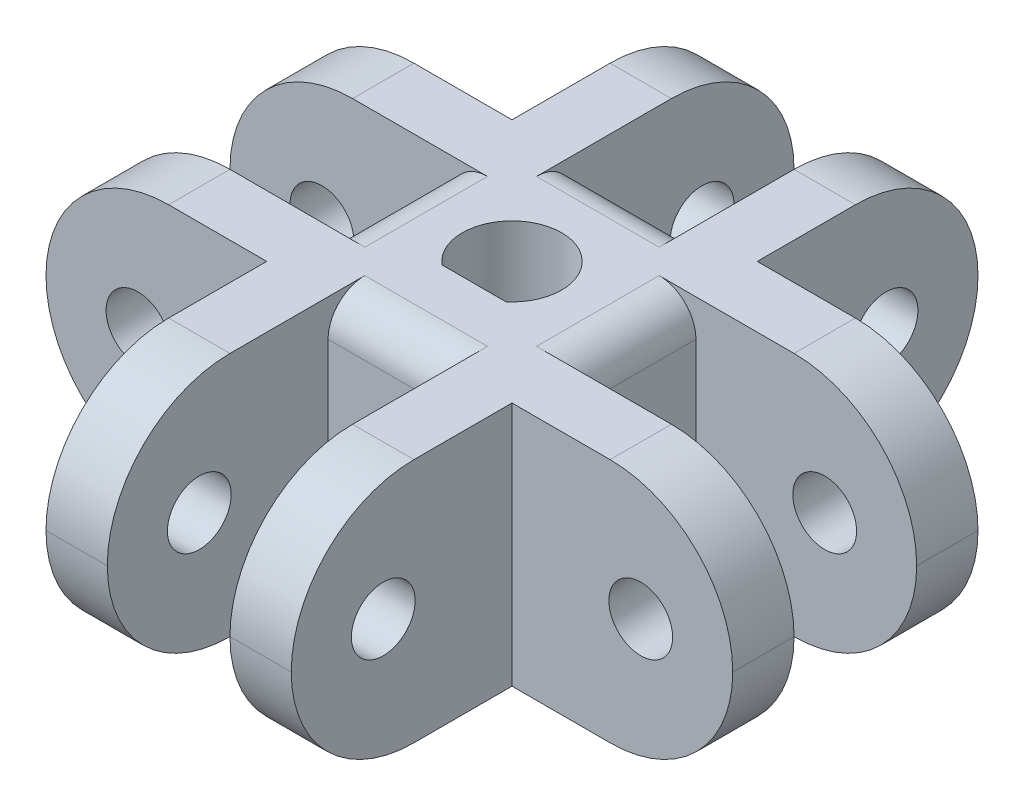
from build123d import *

# Parameters (mm, degrees)
SKETCH1_W           = 20
SKETCH1_H           = 20
SKETCH1_W_2         = 18
SKETCH1_H_2         = 5
SKETCH1_W_3         = 5
SKETCH1_H_3         = 18
BOSS_EXTRUDE1_DEPTH = 20
FILLET1_R           = 10
SKETCH2_R           = 2.6
CUT_EXTRUDE1_DEPTH  = 20
CIRPATTERN1_COUNT   = 4
FILLET2_R           = 3


with BuildPart() as part:
    # Sketch1 → Boss-Extrude1 (new body)
    # profile 1 of 9: a face of its own
    with BuildSketch(Plane(origin=(0, 0, 0), x_dir=(1, 0, 0), z_dir=(0, 1, 0))):
        Rectangle(SKETCH1_W, SKETCH1_H)
        with BuildLine():
            ThreePointArc((2.606242506, -3.1), (0, 4.05), (-2.606242506, -3.1))
            Line((-2.606242506, -3.1), (2.606242506, -3.1))
        make_face(mode=Mode.SUBTRACT)
    # profile 2 of 9: a face of its own
    with BuildSketch(Plane(origin=(0, 0, 0), x_dir=(1, 0, 0), z_dir=(0, 1, 0))):
        with Locations((-19, -7.5)):
            Rectangle(SKETCH1_W_2, SKETCH1_H_2)
    # profile 3 of 9: a face of its own
    with BuildSketch(Plane(origin=(0, 0, 0), x_dir=(1, 0, 0), z_dir=(0, 1, 0))):
        with Locations((-19, 7.5)):
            Rectangle(SKETCH1_W_2, SKETCH1_H_2)
    # profile 4 of 9: a face of its own
    with BuildSketch(Plane(origin=(0, 0, 0), x_dir=(1, 0, 0), z_dir=(0, 1, 0))):
        with Locations((-7.5, 19)):
            Rectangle(SKETCH1_W_3, SKETCH1_H_3)
    # profile 5 of 9: a face of its own
    with BuildSketch(Plane(origin=(0, 0, 0), x_dir=(1, 0, 0), z_dir=(0, 1, 0))):
        with Locations((7.5, 19)):
            Rectangle(SKETCH1_W_3, SKETCH1_H_3)
    # profile 6 of 9: a face of its own
    with BuildSketch(Plane(origin=(0, 0, 0), x_dir=(1, 0, 0), z_dir=(0, 1, 0))):
        with Locations((19, 7.5)):
            Rectangle(SKETCH1_W_2, SKETCH1_H_2)
    # profile 7 of 9: a face of its own
    with BuildSketch(Plane(origin=(0, 0, 0), x_dir=(1, 0, 0), z_dir=(0, 1, 0))):
        with Locations((19, -7.5)):
            Rectangle(SKETCH1_W_2, SKETCH1_H_2)
    # profile 8 of 9: a face of its own
    with BuildSketch(Plane(origin=(0, 0, 0), x_dir=(1, 0, 0), z_dir=(0, 1, 0))):
        with Locations((7.5, -19)):
            Rectangle(SKETCH1_W_3, SKETCH1_H_3)
    # profile 9 of 9: a face of its own
    with BuildSketch(Plane(origin=(0, 0, 0), x_dir=(1, 0, 0), z_dir=(0, 1, 0))):
        with Locations((-7.5, -19)):
            Rectangle(SKETCH1_W_3, SKETCH1_H_3)
    extrude(amount=BOSS_EXTRUDE1_DEPTH)

    # Fillet1
    fillet1_edges = [part.edges().sort_by_distance(p)[0] for p in [
        (-28, 0, 7.5),
        (-28, 20, 7.5),
        (-28, 0, -7.5),
        (-28, 20, -7.5),
        (-7.5, 0, -28),
        (-7.5, 20, -28),
        (7.5, 0, -28),
        (7.5, 20, -28),
        (28, 0, -7.5),
        (28, 20, -7.5),
        (28, 0, 7.5),
        (28, 20, 7.5),
        (7.5, 0, 28),
        (7.5, 20, 28),
        (-7.5, 0, 28),
        (-7.5, 20, 28),
    ]]
    fillet(fillet1_edges, radius=FILLET1_R - 0.0001)  # a hair under: the kernel refuses the full size

    # Sketch2 → Cut-Extrude1 (cut)
    with BuildSketch(Plane.XY.offset(10)):
        with Locations((-20.5, 10)):
            Circle(SKETCH2_R)
    cut_extrude1 = extrude(amount=-CUT_EXTRUDE1_DEPTH, mode=Mode.SUBTRACT)

    # CirPattern1: Cut-Extrude1 ×4 about axis
    cirpattern1_axis = Axis((0, 21, 0), (0, -1, 0))
    for i in range(1, CIRPATTERN1_COUNT):
        add(cut_extrude1.rotate(cirpattern1_axis, i * 360 / CIRPATTERN1_COUNT), mode=Mode.SUBTRACT)

    # Fillet2
    fillet2_edges = [part.edges().sort_by_distance(p)[0] for p in [
        (-10, 20, 0),
        (0, 20, 10),
        (-10, 0, 0),
        (0, 0, -10),
        (10, 0, 0),
        (0, 0, 10),
        (10, 20, 0),
        (0, 20, -10),
    ]]
    fillet(fillet2_edges, radius=FILLET2_R)


solid = part.part
